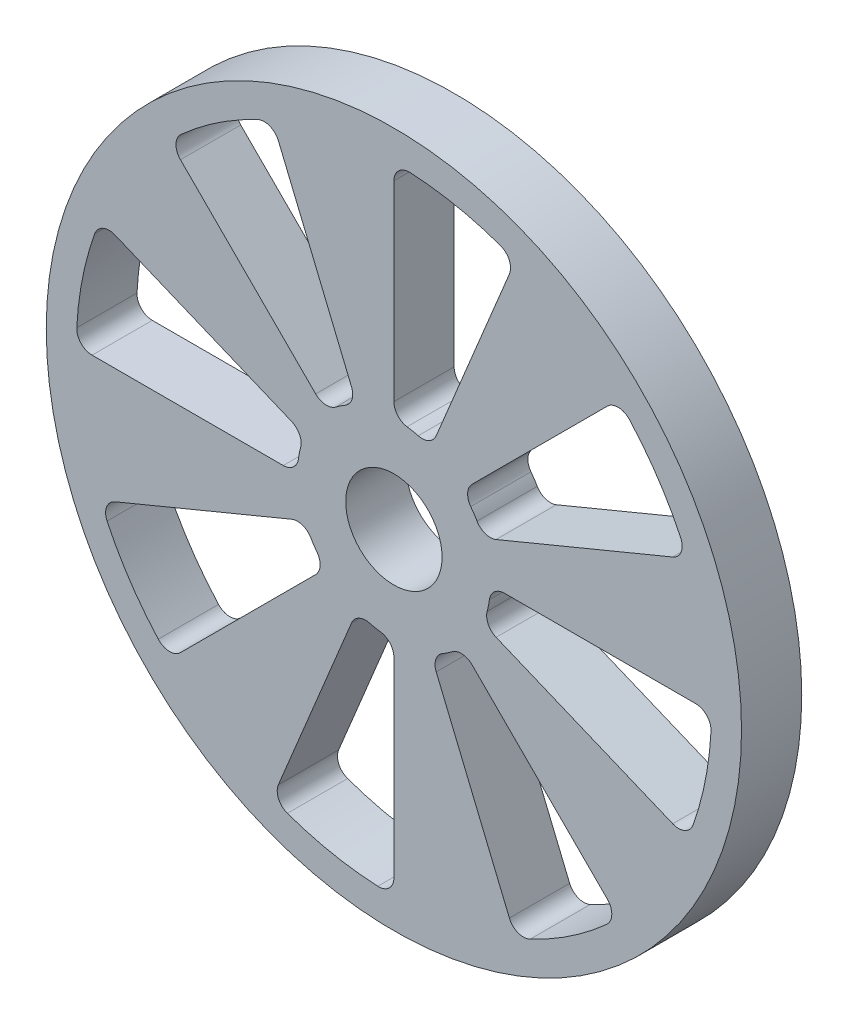
from build123d import *

# Parameters (mm, degrees)
SKETCH1_R           = 28.855
SKETCH1_R_2         = 4
BOSS_EXTRUDE1_DEPTH = 5
FILLET2_R           = 1.27


with BuildPart() as part:
    # Sketch1 → Boss-Extrude1 (new body)
    with BuildSketch(Plane.XY):
        Circle(SKETCH1_R)
        with BuildLine():
            Line((-10.08562186, 24.348845079), (-3.061467459, 7.39103626))
            ThreePointArc((-3.061467459, 7.39103626), (-4.444561864, 6.651756898), (-5.656854249, 5.656854249))
            Line((-5.656854249, 5.656854249), (-18.635799218, 18.635799218))
            ThreePointArc((-18.635799218, 18.635799218), (-14.642053491, 21.913381632), (-10.08562186, 24.348845079))
        make_face(mode=Mode.SUBTRACT)
        with BuildLine():
            Line((0, 8), (0, 26.355))
            ThreePointArc((0, 26.355), (5.141605437, 25.848596065), (10.08562186, 24.348845079))
            Line((10.08562186, 24.348845079), (3.061467459, 7.39103626))
            ThreePointArc((3.061467459, 7.39103626), (1.560722576, 7.846282243), (0, 8))
        make_face(mode=Mode.SUBTRACT)
        with BuildLine():
            ThreePointArc((7.39103626, 3.061467459), (6.651756898, 4.444561864), (5.656854249, 5.656854249))
            Line((5.656854249, 5.656854249), (18.635799218, 18.635799218))
            ThreePointArc((18.635799218, 18.635799218), (21.913381632, 14.642053491), (24.348845079, 10.08562186))
            Line((24.348845079, 10.08562186), (7.39103626, 3.061467459))
        make_face(mode=Mode.SUBTRACT)
        with BuildLine():
            ThreePointArc((7.39103626, -3.061467459), (7.846282243, -1.560722576), (8, 0))
            Line((8, 0), (26.355, 0))
            ThreePointArc((26.355, 0), (25.848596065, -5.141605437), (24.348845079, -10.08562186))
            Line((24.348845079, -10.08562186), (7.39103626, -3.061467459))
        make_face(mode=Mode.SUBTRACT)
        with BuildLine():
            ThreePointArc((3.061467459, -7.39103626), (4.444561864, -6.651756898), (5.656854249, -5.656854249))
            Line((5.656854249, -5.656854249), (18.635799218, -18.635799218))
            ThreePointArc((18.635799218, -18.635799218), (14.642053491, -21.913381632), (10.08562186, -24.348845079))
            Line((10.08562186, -24.348845079), (3.061467459, -7.39103626))
        make_face(mode=Mode.SUBTRACT)
        with BuildLine():
            ThreePointArc((-3.061467459, -7.39103626), (-1.560722576, -7.846282243), (0, -8))
            Line((0, -8), (0, -26.355))
            ThreePointArc((0, -26.355), (-5.141605437, -25.848596065), (-10.08562186, -24.348845079))
            Line((-10.08562186, -24.348845079), (-3.061467459, -7.39103626))
        make_face(mode=Mode.SUBTRACT)
        with BuildLine():
            ThreePointArc((-7.39103626, -3.061467459), (-6.651756898, -4.444561864), (-5.656854249, -5.656854249))
            Line((-5.656854249, -5.656854249), (-18.635799218, -18.635799218))
            ThreePointArc((-18.635799218, -18.635799218), (-21.913381632, -14.642053491), (-24.348845079, -10.08562186))
            Line((-24.348845079, -10.08562186), (-7.39103626, -3.061467459))
        make_face(mode=Mode.SUBTRACT)
        with BuildLine():
            ThreePointArc((-7.39103626, 3.061467459), (-7.846282243, 1.560722576), (-8, 0))
            Line((-8, 0), (-26.355, 0))
            ThreePointArc((-26.355, 0), (-25.848596065, 5.141605437), (-24.348845079, 10.08562186))
            Line((-24.348845079, 10.08562186), (-7.39103626, 3.061467459))
        make_face(mode=Mode.SUBTRACT)
        Circle(SKETCH1_R_2, mode=Mode.SUBTRACT)
    extrude(amount=BOSS_EXTRUDE1_DEPTH)

    # Fillet2
    fillet2_edges = [part.edges().sort_by_distance(p)[0] for p in [
        (-3.061467459, 7.39103626, 2.5),
        (-7.39103626, -3.061467459, 2.5),
        (-7.39103626, 3.061467459, 2.5),
        (-5.656854249, -5.656854249, 2.5),
        (0, -8, 2.5),
        (-3.061467459, -7.39103626, 2.5),
        (5.656854249, 5.656854249, 2.5),
        (7.39103626, -3.061467459, 2.5),
        (3.061467459, -7.39103626, 2.5),
        (5.656854249, -5.656854249, 2.5),
        (18.635799218, -18.635799218, 2.5),
        (26.355, 0, 2.5),
        (0, 8, 2.5),
        (8, 0, 2.5),
        (10.08562186, -24.348845079, 2.5),
        (-10.08562186, -24.348845079, 2.5),
        (-26.355, 0, 2.5),
        (-18.635799218, 18.635799218, 2.5),
        (0, 26.355, 2.5),
        (18.635799218, 18.635799218, 2.5),
        (7.39103626, 3.061467459, 2.5),
        (3.061467459, 7.39103626, 2.5),
        (-5.656854249, 5.656854249, 2.5),
        (-8, 0, 2.5),
        (-18.635799218, -18.635799218, 2.5),
        (0, -26.355, 2.5),
        (24.348845079, -10.08562186, 2.5),
        (24.348845079, 10.08562186, 2.5),
        (10.08562186, 24.348845079, 2.5),
        (-10.08562186, 24.348845079, 2.5),
        (-24.348845079, 10.08562186, 2.5),
        (-24.348845079, -10.08562186, 2.5),
    ]]
    fillet(fillet2_edges, radius=FILLET2_R)


solid = part.part
